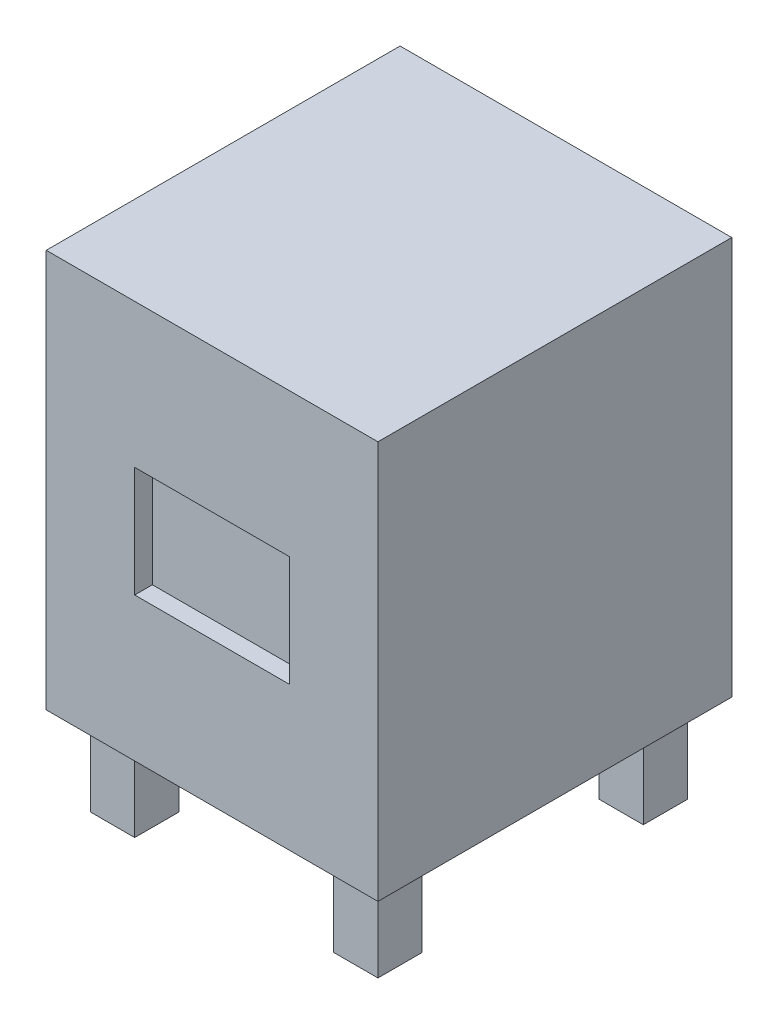
from build123d import *

# Parameters (mm, degrees)
SKETCH1_W                 = 95.25
SKETCH1_H                 = 114.3
BOSS_EXTRUDE1_DEPTH       = 101.6
SKETCH2_W                 = 44.45
SKETCH2_H                 = 31.75
CUT_EXTRUDE1_DEPTH        = 5.08
SKETCH3_W                 = 12.7
SKETCH3_H                 = 12.7
BOSS_EXTRUDE2_DEPTH       = 25.4
F_4_40_TAPPED_HOLE2_D     = 2.2606
F_4_40_TAPPED_HOLE2_DEPTH = 7.6
F_4_40_TAPPED_HOLE2_TIP   = 0.679152758


with BuildPart() as part:
    # Sketch1 → Boss-Extrude1 (new body)
    with BuildSketch(Plane.XY):
        Rectangle(SKETCH1_W, SKETCH1_H)
    extrude(amount=BOSS_EXTRUDE1_DEPTH)

    # Sketch2 → Cut-Extrude1 (cut)
    with BuildSketch(Plane.XY.offset(101.6)):
        Rectangle(SKETCH2_W, SKETCH2_H)
    extrude(amount=-CUT_EXTRUDE1_DEPTH, mode=Mode.SUBTRACT)

    # Sketch3 → Boss-Extrude2 (add)
    with BuildSketch(Plane.XZ.offset(57.15)):
        with Locations((-34.925, 88.9)):
            Rectangle(SKETCH3_W, SKETCH3_H)
        with Locations((-34.925, 12.7)):
            Rectangle(SKETCH3_W, SKETCH3_H)
        with Locations((34.925, 88.9)):
            Rectangle(SKETCH3_W, SKETCH3_H)
        with Locations((34.925, 12.7)):
            Rectangle(SKETCH3_W, SKETCH3_H)
    extrude(amount=BOSS_EXTRUDE2_DEPTH)

    # #4-40 Tapped Hole2
    with Locations(Plane(origin=(17.145, 8.636, 0), x_dir=(-1, 0, 0), z_dir=(0, 0, -1))):
        with Locations((0, 0), (34.29, 0), (34.29, -17.272), (0, -17.272)):
            Hole(F_4_40_TAPPED_HOLE2_D / 2, depth=F_4_40_TAPPED_HOLE2_DEPTH)
            with Locations((0, 0, -(F_4_40_TAPPED_HOLE2_DEPTH + F_4_40_TAPPED_HOLE2_TIP / 2))):  # 118° drill point
                Cone(0, F_4_40_TAPPED_HOLE2_D / 2, F_4_40_TAPPED_HOLE2_TIP, mode=Mode.SUBTRACT)


solid = part.part
